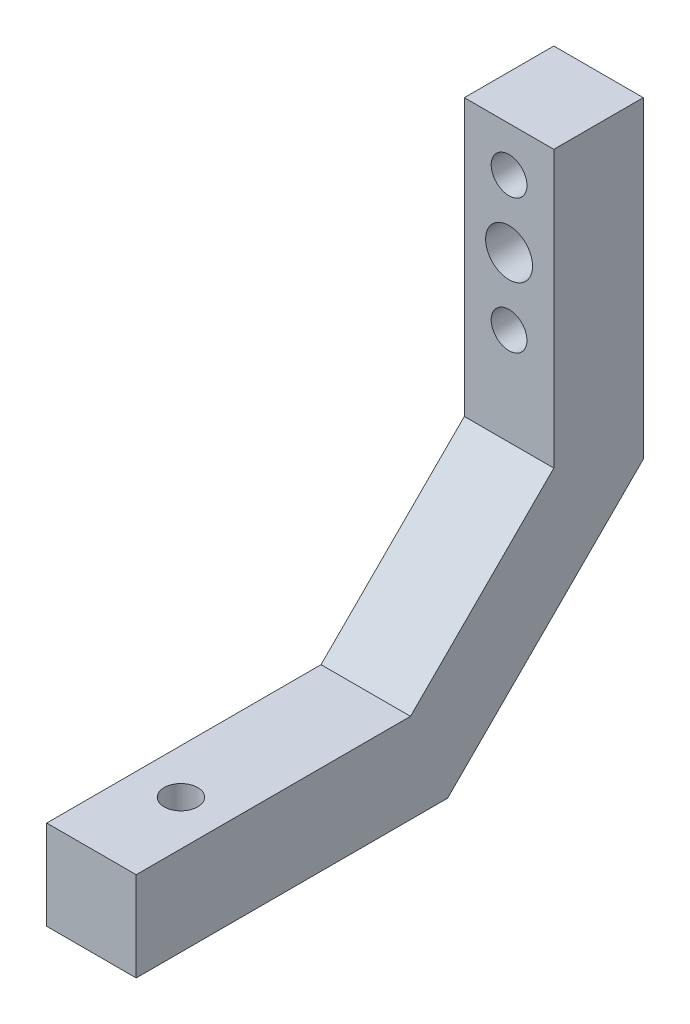
from build123d import *

# Parameters (mm, degrees)
BOSS_EXTRUDE1_DEPTH      = 4
BOSS_EXTRUDE1_DEPTH_BACK = 4
SKETCH3_R                = 1.5
CUT_EXTRUDE1_DEPTH       = 59.974279139
SKETCH4_R                = 2.1
SKETCH4_R_2              = 1.6
CUT_EXTRUDE2_DEPTH       = 52.677128403


with BuildPart() as part:
    # Sketch1 → Boss-Extrude1 (new, two sides: drawn at the far end of the back side and taken through both)
    with BuildSketch(Plane(origin=(0, 0, 0), x_dir=(0, 0, -1), z_dir=(1, 0, 0)).offset(-BOSS_EXTRUDE1_DEPTH_BACK)):
        Polygon((-8, 10), (0, 10), (0, -18), (-17.5, -35.5), (-37.34, -35.5), (-45.34, -35.5), (-45.34, -27.5), (-37.34, -27.5), (-20.813708499, -27.5), (-8, -14.686291501), align=None)
    extrude(amount=BOSS_EXTRUDE1_DEPTH + BOSS_EXTRUDE1_DEPTH_BACK)

    # Sketch3 → Cut-Extrude1 (cut, through all)
    with BuildSketch(Plane(origin=(0, -27.5, 0), x_dir=(1, 0, 0), z_dir=(0, 1, 0))):
        with Locations((0, -37.34)):
            Circle(SKETCH3_R)
    extrude(amount=-CUT_EXTRUDE1_DEPTH, mode=Mode.SUBTRACT)

    # Sketch4 → Cut-Extrude2 (cut, through all)
    with BuildSketch(Plane.XY.offset(8)):
        Circle(SKETCH4_R)
        with Locations((0, 6)):
            Circle(SKETCH4_R_2)
        with Locations((0, -6)):
            Circle(SKETCH4_R_2)
    extrude(amount=-CUT_EXTRUDE2_DEPTH, mode=Mode.SUBTRACT)


solid = part.part
